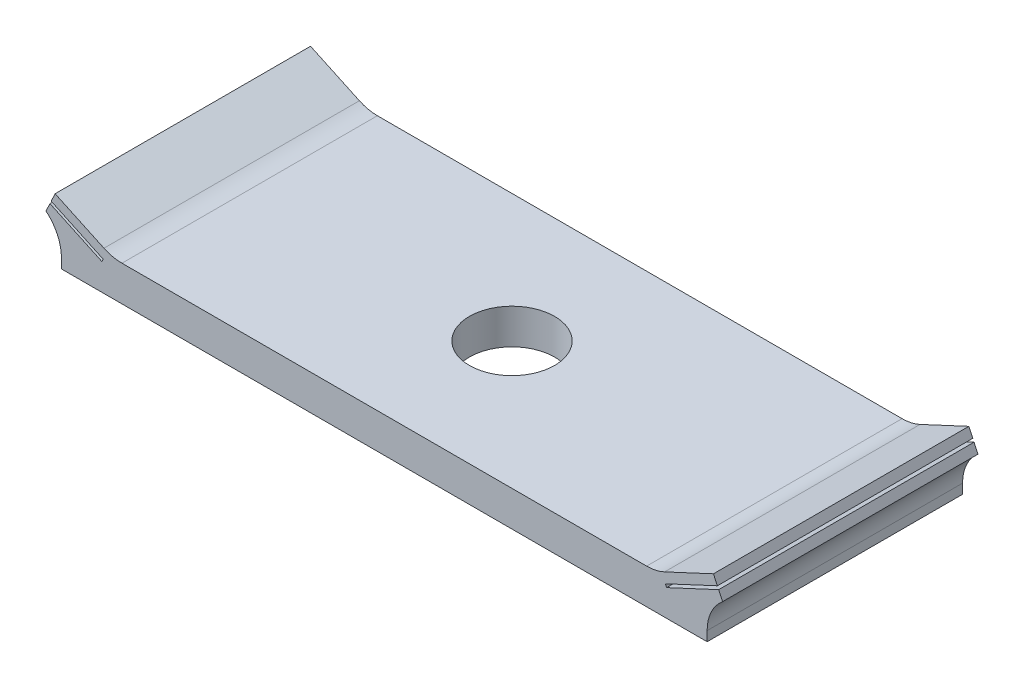
from build123d import *

# Parameters (mm, degrees)
BOSS_EXTRUDE1_DEPTH = 30
FILLET1_R           = 5
SKETCH2_R           = 5
CUT_EXTRUDE1_DEPTH  = 30


with BuildPart() as part:
    # Sketch1 → Boss-Extrude1 (new body)
    with BuildSketch(Plane.XY):
        Polygon((37.92, -2.070510622), (37.92, 2.070510622), (35.334085277, 2.070510622), (33.1622407, 1.057762863), (33.014324308, 1.374970589), (34.505914723, 2.070510622), (31.92, 2.070510622), (-31.92, 2.070510622), (-34.505914723, 2.070510622), (-33.014324308, 1.374970589), (-33.1622407, 1.057762863), (-35.334085277, 2.070510622), (-37.92, 2.070510622), (-37.92, -2.070510622), align=None)
        Polygon((-39.732615574, 2.915747145), (-37.92, 2.070510622), (-35.334085277, 2.070510622), (-39.270755184, 3.906209947), align=None)
        Polygon((-34.505914723, 2.070510622), (-31.92, 2.070510622), (-38.660978403, 5.213880475), (-39.122838793, 4.223417673), align=None)
        Polygon((31.92, 2.070510622), (34.505914723, 2.070510622), (39.122838793, 4.223417673), (38.660978403, 5.213880475), align=None)
        Polygon((35.334085277, 2.070510622), (37.92, 2.070510622), (39.732615574, 2.915747145), (39.270755184, 3.906209947), align=None)
    extrude(amount=BOSS_EXTRUDE1_DEPTH)

    # Fillet1
    # the kernel refuses this fillet: 5 mm, written as the material it adds along each edge
    with BuildSketch(Plane(origin=(37.92, 2.070510622, 0), x_dir=(0, -1, 0), z_dir=(0, 0, 1))) as fillet1_piece_1:
        with BuildLine():
            CenterArc((3.007110881, 5), FILLET1_R, 219.603933445, 50.396066555)
            Line((-0.845236523, 1.812615574), (-0.922283472, 1.748867886))
            ThreePointArc((-0.922283472, 1.748867886), (-0.51324904, 0.864045961), (-0.090630779, -0.042261826))
            Line((-0.090630779, -0.042261826), (0, -0.1))
            Line((0, -0.1), (3.007110881, -0.1))
            Line((3.007110881, -0.1), (3.007110881, 0))
        make_face()
    extrude(amount=30)
    with BuildSketch(Plane(origin=(-37.92, 2.070510622, 0), x_dir=(0, -1, 0), z_dir=(0, 0, 1))) as fillet1_piece_2:
        with BuildLine():
            CenterArc((3.007110881, -5), FILLET1_R, 90, 50.396066555)
            Line((-0.845236523, -1.812615574), (-0.922283472, -1.748867886))
            ThreePointArc((-0.922283472, -1.748867886), (-0.51324904, -0.864045961), (-0.090630779, 0.042261826))
            Line((-0.090630779, 0.042261826), (0, 0.1))
            Line((0, 0.1), (3.007110881, 0.1))
            Line((3.007110881, 0.1), (3.007110881, 0))
        make_face()
    extrude(amount=30)
    with BuildSketch(Plane(origin=(31.92, 2.070510622, 0), x_dir=(-1, 0, 0), z_dir=(0, 0, 1)), Plane(origin=(-31.92, 2.070510622, 0), x_dir=(-0.9063077870366495, 0.4226182617407004, 0), z_dir=(0, 0, 1))) as fillet1_piece_3:
        with BuildLine():
            CenterArc((FILLET1_R * 0.221694662643, -FILLET1_R), FILLET1_R, 90, 25)
            Line((-FILLET1_R * 0.200923599098, -FILLET1_R * 0.0936922129634), (-FILLET1_R * 0.209375964333, -FILLET1_R * 0.0755660572226))
            Line((-FILLET1_R * 0.209375964333, -FILLET1_R * 0.0755660572226), (-FILLET1_R * 0.00443389325286, FILLET1_R * 0.02))
            Line((-FILLET1_R * 0.00443389325286, FILLET1_R * 0.02), (FILLET1_R * 0.221694662643, FILLET1_R * 0.02))
            Line((FILLET1_R * 0.221694662643, FILLET1_R * 0.02), (FILLET1_R * 0.221694662643, 0))
        make_face()
    extrude(amount=30)

    # Sketch2 → Cut-Extrude1 (cut)
    with BuildSketch(Plane(origin=(0, 2.070510622, 0), x_dir=(1, 0, 0), z_dir=(0, 1, 0))):
        with Locations(Location((0, -15, 0), (0, 0, 270))):
            Circle(SKETCH2_R)
    extrude(amount=-CUT_EXTRUDE1_DEPTH, mode=Mode.SUBTRACT)


solid = part.part
